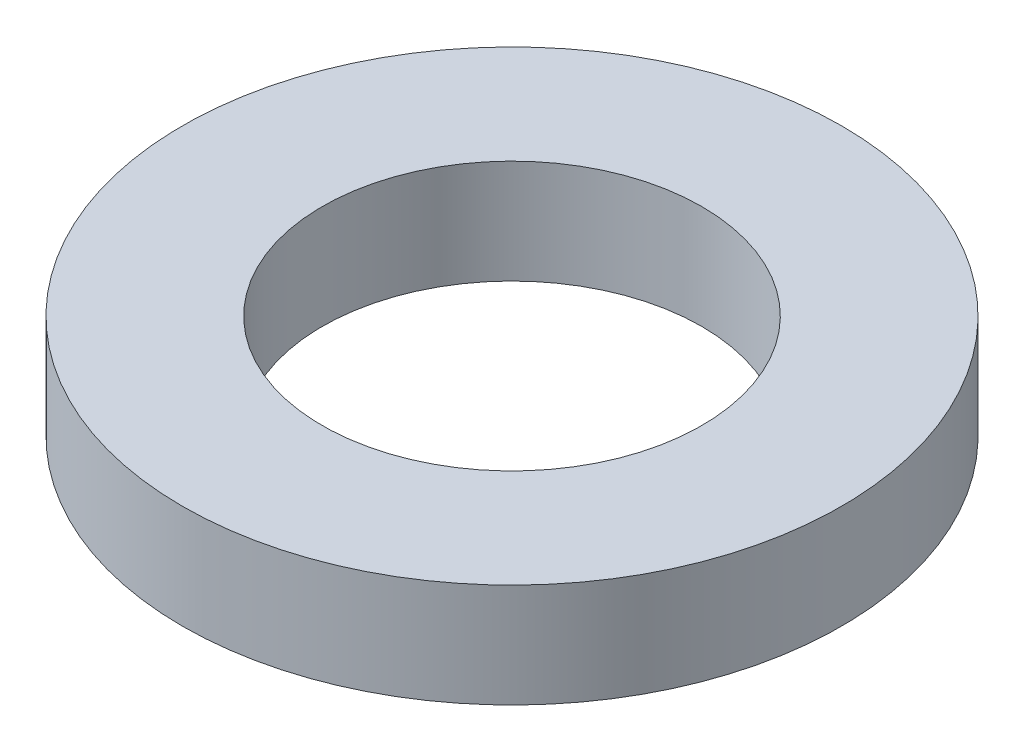
from build123d import *

# Parameters (mm, degrees)
SKETCH1_R           = 82.5
BOSS_EXTRUDE1_DEPTH = 26
SKETCH2_R           = 47.5
CUT_EXTRUDE1_DEPTH  = 120.534513844


with BuildPart() as part:
    # Sketch1 → Boss-Extrude1 (new body)
    with BuildSketch(Plane(origin=(0, 0, 0), x_dir=(1, 0, 0), z_dir=(0, 1, 0))):
        Circle(SKETCH1_R)
    extrude(amount=BOSS_EXTRUDE1_DEPTH)

    # Sketch2 → Cut-Extrude1 (cut, through all)
    with BuildSketch(Plane(origin=(0, 0, 0), x_dir=(1, 0, 0), z_dir=(0, 1, 0))):
        Circle(SKETCH2_R)
    extrude(amount=CUT_EXTRUDE1_DEPTH, mode=Mode.SUBTRACT)


solid = part.part
